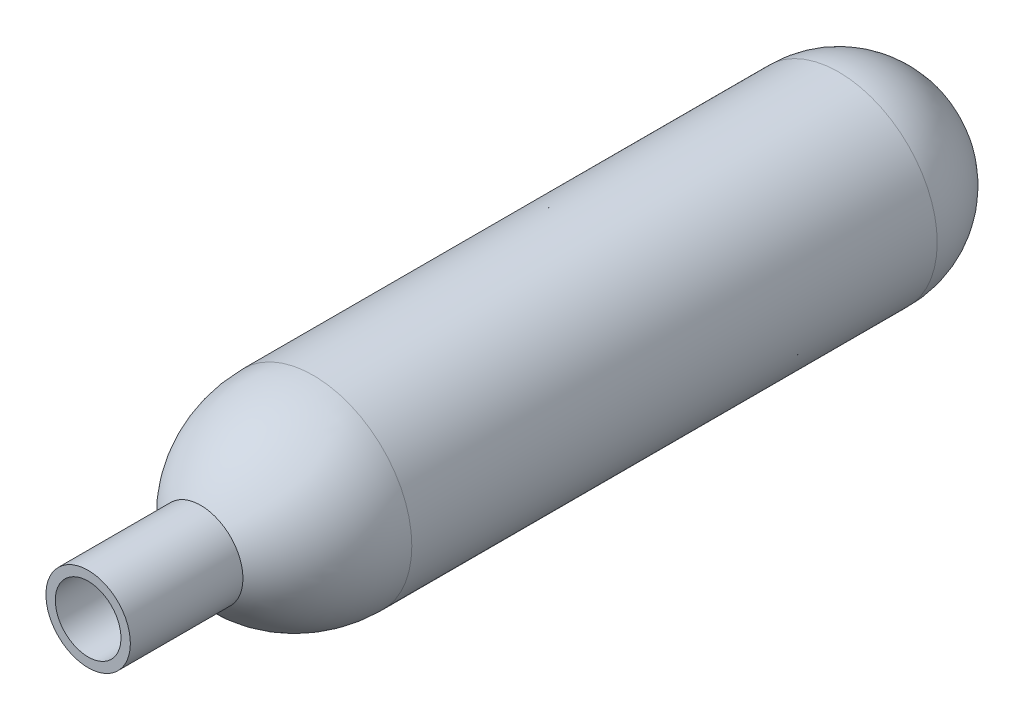
from build123d import *


# Read off the part's stored shape, not the designer's step: Shell1
with BuildPart() as part:
    # Sketch1 → Revolve1 (revolve)
    with BuildSketch(Plane(origin=(0, 0, 0), x_dir=(0, 0, -1), z_dir=(1, 0, 0)), mode=Mode.PRIVATE) as revolve1_sk:
        with BuildLine():
            Line((0.74336912, 4.5), (12.74336912, 4.5))
            ThreePointArc((12.74336912, 4.5), (18.035165187, 8.916407865), (24.74336912, 10.5))
            Line((24.74336912, 10.5), (80.74336912, 10.5))
            ThreePointArc((80.74336912, 10.5), (88.167990322, 7.424621202), (91.24336912, 0))
            Line((91.24336912, 0), (0.74336912, 0))
            Line((0.74336912, 0), (0.74336912, 4.5))
        make_face()
    revolve(revolve1_sk.sketch.rotate(Axis((0, 0, 0), (0, 0, -1)), 90), axis=Axis((0, 0, 0), (0, 0, -1)))

    # Shell1 outline → Shell1 (revolve, cut)
    with BuildSketch(Plane.XZ):
        with BuildLine():
            Line((0, -0.74336912), (0, -90.24336912))
            ThreePointArc((0, -90.24336912), (6.717514422, -87.46088354), (9.5, -80.743369117))
            Line((9.5, -80.743369117), (9.5, -24.74336912))
            ThreePointArc((9.5, -24.74336912), (7.909673646, -18.262628421), (3.5, -13.254243826))
            Line((3.5, -13.254243826), (3.5, -0.74336912))
            Line((3.5, -0.74336912), (0, -0.74336912))
        make_face()
    revolve(axis=Axis((0, 0, 0), (0, 0, 1)), mode=Mode.SUBTRACT)


solid = part.part
